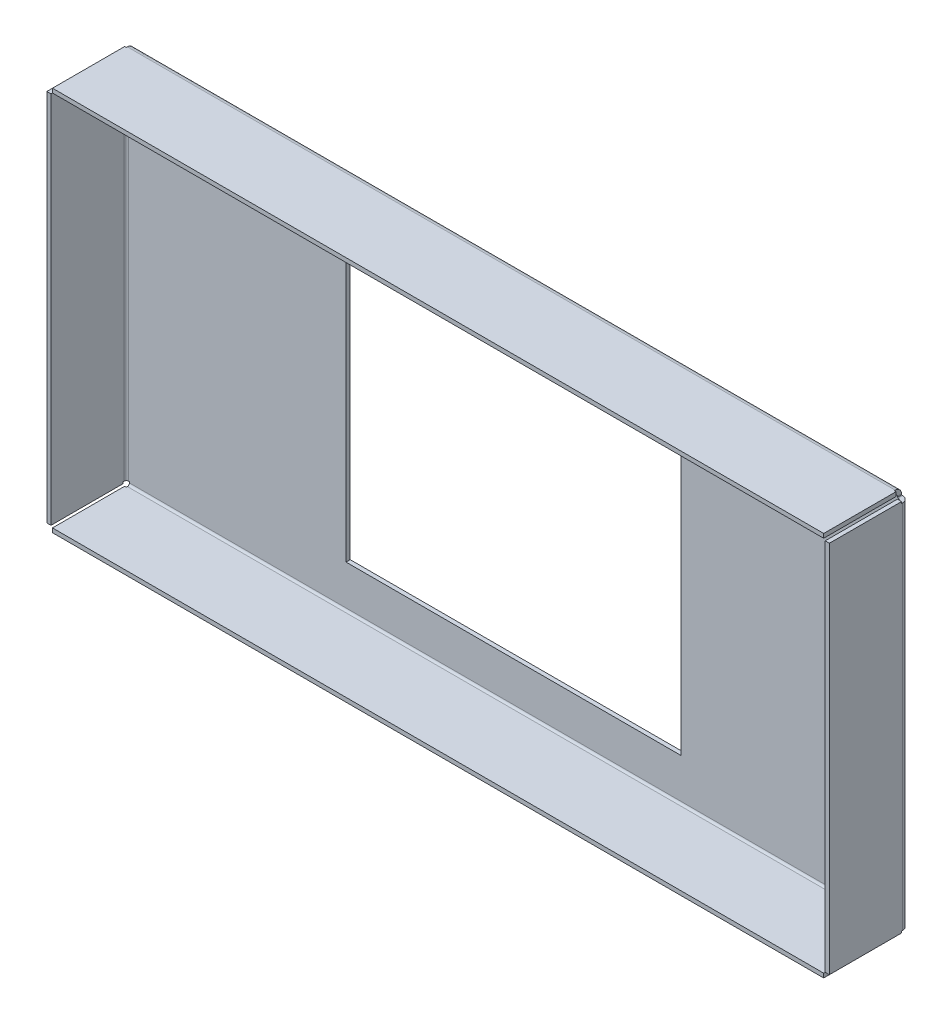
from build123d import *

# Parameters (mm, degrees)
SKETCH1_W                    = 370
SKETCH1_H                    = 180
BOSS_EXTRUDE1_DEPTH          = 18
CONVERT_SOLID1_START         = -90
CONVERT_SOLID1_DEPTH         = 180
CONVERT_SOLID1_START_2       = -92
CONVERT_SOLID1_2_DEPTH       = 3.5
CONVERT_SOLID1_START_3       = 88.5
CONVERT_SOLID1_3_DEPTH       = 3.5
CONVERT_SOLID1_START_4       = -88.5
CONVERT_SOLID1_4_DEPTH       = 177
CONVERT_SOLID1_START_5       = -89
CONVERT_SOLID1_5_OUTLINE_W   = 367
CONVERT_SOLID1_5_OUTLINE_H   = 2
CONVERT_SOLID1_5_OUTLINE_W_2 = 2
CONVERT_SOLID1_5_OUTLINE_H_2 = 34.5
CONVERT_SOLID1_5_DEPTH       = 178
CONVERT_SOLID1_START_6       = -89.292893219
CONVERT_SOLID1_6_OUTLINE_W   = 2
CONVERT_SOLID1_6_OUTLINE_H   = 34.5
CONVERT_SOLID1_6_DEPTH       = 178.585786438
CONVERT_SOLID1_START_7       = -183.5
CONVERT_SOLID1_7_DEPTH       = 367
CONVERT_SOLID1_START_8       = -184.292893219
CONVERT_SOLID1_8_OUTLINE_W   = 2
CONVERT_SOLID1_8_OUTLINE_H   = 34.5
CONVERT_SOLID1_8_DEPTH       = 368.585786438
SKETCH6_W                    = 160
SKETCH6_H                    = 140
CUT_EXTRUDE1_DEPTH           = 36


with BuildPart() as part:
    # Sketch1 → Boss-Extrude1 (new, symmetric)
    with BuildSketch(Plane.XY):
        Rectangle(SKETCH1_W, SKETCH1_H)
    extrude(amount=BOSS_EXTRUDE1_DEPTH, both=True)

    # Convert-Solid1: read off the stored shape, not the designer's step
    # Convert-Solid1 outline → Convert-Solid1 (cut)
    with BuildSketch(Plane(origin=(0, 0, 0), x_dir=(1, 0, 0), z_dir=(0, 1, 0)).offset(CONVERT_SOLID1_START)):
        with BuildLine():
            ThreePointArc((-184, 18), (-184.707106781, 17.707106781), (-185, 17))
            Line((-185, 17), (-185, -18))
            Line((-185, -18), (185, -18))
            Line((185, -18), (185, 17))
            ThreePointArc((185, 17), (184.707106781, 17.707106781), (184, 18))
            Line((184, 18), (-184, 18))
        make_face()
    extrude(amount=CONVERT_SOLID1_DEPTH, mode=Mode.SUBTRACT)

    # Convert-Solid1 2 outline → Convert-Solid1 2 (cut)
    with BuildSketch(Plane(origin=(0, 0, 0), x_dir=(1, 0, 0), z_dir=(0, 1, 0)).offset(CONVERT_SOLID1_START_2)):
        with BuildLine():
            ThreePointArc((-185, 17), (-184.707106781, 17.707106781), (-184, 18))
            Line((-184, 18), (-185, 18))
            Line((-185, 18), (-185, 17))
        make_face()
        with BuildLine():
            Line((185, 18), (184, 18))
            ThreePointArc((184, 18), (184.707106781, 17.707106781), (185, 17))
            Line((185, 17), (185, 18))
        make_face()
    extrude(amount=CONVERT_SOLID1_2_DEPTH, mode=Mode.SUBTRACT)

    # Convert-Solid1 3 outline → Convert-Solid1 3 (cut)
    with BuildSketch(Plane(origin=(0, 0, 0), x_dir=(1, 0, 0), z_dir=(0, 1, 0)).offset(CONVERT_SOLID1_START_3)):
        with BuildLine():
            ThreePointArc((-185, 17), (-184.707106781, 17.707106781), (-184, 18))
            Line((-184, 18), (-185, 18))
            Line((-185, 18), (-185, 17))
        make_face()
        with BuildLine():
            Line((185, 18), (184, 18))
            ThreePointArc((184, 18), (184.707106781, 17.707106781), (185, 17))
            Line((185, 17), (185, 18))
        make_face()
    extrude(amount=CONVERT_SOLID1_3_DEPTH, mode=Mode.SUBTRACT)

    # Convert-Solid1 4 outline → Convert-Solid1 4 (add)
    with BuildSketch(Plane(origin=(0, 0, 0), x_dir=(1, 0, 0), z_dir=(0, 1, 0)).offset(CONVERT_SOLID1_START_4)):
        with BuildLine():
            Line((185, 18), (185, -18))
            Line((185, -18), (187, -18))
            Line((187, -18), (187, 17))
            ThreePointArc((187, 17), (186.121320344, 19.121320344), (184, 20))
            Line((184, 20), (-184, 20))
            ThreePointArc((-184, 20), (-186.121320344, 19.121320344), (-187, 17))
            Line((-187, 17), (-187, -18))
            Line((-187, -18), (-185, -18))
            Line((-185, -18), (-185, 18))
            Line((-185, 18), (185, 18))
        make_face()
    extrude(amount=CONVERT_SOLID1_4_DEPTH)

    # Convert-Solid1 5 outline → Convert-Solid1 5 (add)
    with BuildSketch(Plane(origin=(0, 0, 0), x_dir=(1, 0, 0), z_dir=(0, 1, 0)).offset(CONVERT_SOLID1_START_5)):
        with Locations((0, 19)):
            Rectangle(CONVERT_SOLID1_5_OUTLINE_W, CONVERT_SOLID1_5_OUTLINE_H)
        with Locations((-186, -0.75)):
            Rectangle(CONVERT_SOLID1_5_OUTLINE_W_2, CONVERT_SOLID1_5_OUTLINE_H_2)
        with Locations((186, -0.75)):
            Rectangle(CONVERT_SOLID1_5_OUTLINE_W_2, CONVERT_SOLID1_5_OUTLINE_H_2)
    extrude(amount=CONVERT_SOLID1_5_DEPTH)

    # Convert-Solid1 6 outline → Convert-Solid1 6 (add)
    with BuildSketch(Plane(origin=(0, 0, 0), x_dir=(1, 0, 0), z_dir=(0, 1, 0)).offset(CONVERT_SOLID1_START_6)):
        with Locations((-186, -0.75)):
            Rectangle(CONVERT_SOLID1_6_OUTLINE_W, CONVERT_SOLID1_6_OUTLINE_H)
        with Locations((186, -0.75)):
            Rectangle(CONVERT_SOLID1_6_OUTLINE_W, CONVERT_SOLID1_6_OUTLINE_H)
    extrude(amount=CONVERT_SOLID1_6_DEPTH)

    # Convert-Solid1 7 outline → Convert-Solid1 7 (add)
    with BuildSketch(Plane.YZ.offset(CONVERT_SOLID1_START_7)):
        with BuildLine():
            Line((92, -17), (92, 18))
            Line((92, 18), (90, 18))
            Line((90, 18), (90, -17))
            ThreePointArc((90, -17), (89.707106781, -17.707106781), (89, -18))
            Line((89, -18), (89, -20))
            ThreePointArc((89, -20), (91.121320344, -19.121320344), (92, -17))
        make_face()
        with BuildLine():
            Line((-92, 18), (-92, -17))
            ThreePointArc((-92, -17), (-91.121320344, -19.121320344), (-89, -20))
            Line((-89, -20), (-89, -18))
            ThreePointArc((-89, -18), (-89.707106781, -17.707106781), (-90, -17))
            Line((-90, -17), (-90, 18))
            Line((-90, 18), (-92, 18))
        make_face()
    extrude(amount=CONVERT_SOLID1_7_DEPTH)

    # Convert-Solid1 8 outline → Convert-Solid1 8 (add)
    with BuildSketch(Plane.YZ.offset(CONVERT_SOLID1_START_8)):
        with Locations((91, 0.75)):
            Rectangle(CONVERT_SOLID1_8_OUTLINE_W, CONVERT_SOLID1_8_OUTLINE_H)
        with Locations((-91, 0.75)):
            Rectangle(CONVERT_SOLID1_8_OUTLINE_W, CONVERT_SOLID1_8_OUTLINE_H)
    extrude(amount=CONVERT_SOLID1_8_DEPTH)

    # Sketch6 → Cut-Extrude1 (cut)
    with BuildSketch(Plane.XY.offset(-18)):
        Rectangle(SKETCH6_W, SKETCH6_H)
    extrude(amount=-CUT_EXTRUDE1_DEPTH, mode=Mode.SUBTRACT)


solid = part.part
